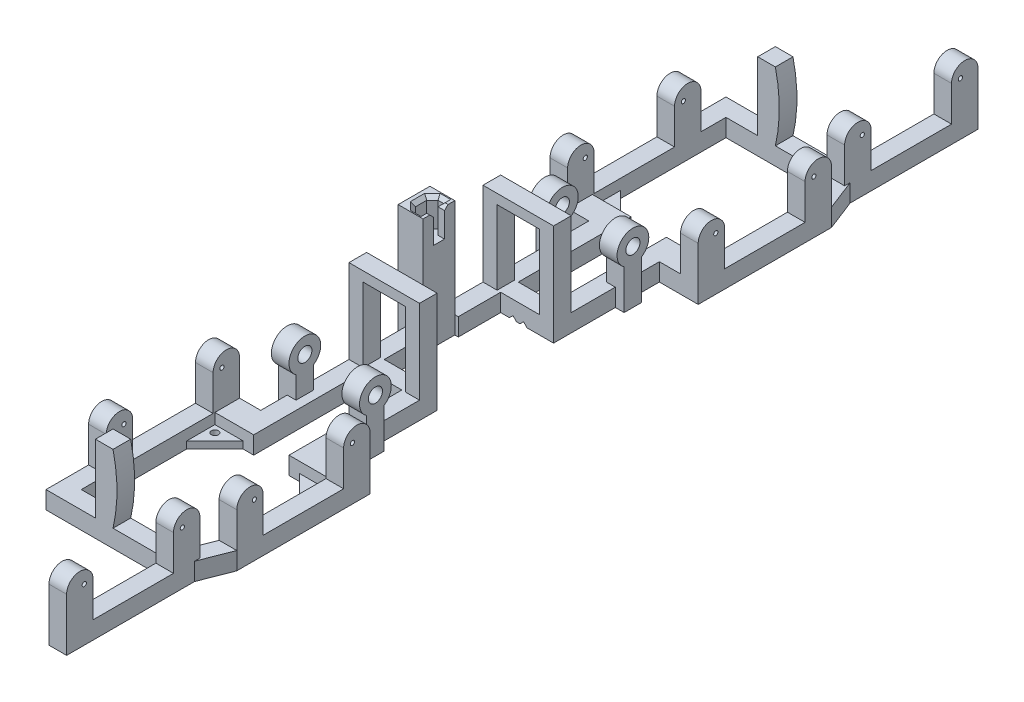
from build123d import *

# Parameters (mm, degrees)
SKETCH_2_5_W               = 5
SKETCH_2_5_H               = 5
RAIL1_DEPTH                = 27.5
ARCHFORTHREAD1_DEPTH       = 2.5
RAIL2_DEPTH                = 2.5
SKETCH_3_W                 = 5
SKETCH_3_H                 = 5
CELLNEST_DEPTH             = 14.5
SKETCH_4_W                 = 7.05
SKETCH_4_H                 = 9
EXTRUDE_6_DEPTH            = 25
EXTRUDE_7_DEPTH            = 8
CHAMFER_1_SIZE             = 1
SKETCH_7_R                 = 2
EXTRUDE_8_DEPTH            = 2.5
SKETCH_12_W                = 16
SKETCH_12_H                = 7
EXTRUDE_9_DEPTH            = 5
SKETCH_13_R                = 0.6
EXTRUDE_10_DEPTH           = 5
EXTRUDE_11_DEPTH           = 5
PATTERN_LINEAR_1_COUNT     = 2
PATTERN_LINEAR_1_PITCH     = 45
EXTRUDE_12_DEPTH           = 5
EXTRUDE_13_DEPTH           = 5
MIRROR_13_COPY_1_DEPTH     = 2.5
MIRROR_13_COPY_2_DEPTH     = 2.5
MIRROR_21_COPY_1_SKETCH_W  = 5
MIRROR_21_COPY_1_SKETCH_H  = 5
MIRROR_21_COPY_1_DEPTH     = 27.5
MIRROR_21_COPY_2_SKETCH_W  = 5
MIRROR_21_COPY_2_SKETCH_H  = 5
MIRROR_21_COPY_2_DEPTH     = 27.5
MIRROR_21_COPY_3_DEPTH     = 2.5
MIRROR_21_COPY_4_DEPTH     = 2.5
MIRROR_22_COPY_1_SKETCH_R  = 2
MIRROR_22_COPY_1_DEPTH     = 2.5
MIRROR_22_COPY_2_SKETCH_R  = 2
MIRROR_22_COPY_2_DEPTH     = 2.5
MIRROR_23_COPY_1_SKETCH_W  = 16
MIRROR_23_COPY_1_SKETCH_H  = 7
MIRROR_23_COPY_1_DEPTH     = 5
MIRROR_23_COPY_2_SKETCH_R  = 0.6
MIRROR_23_COPY_2_DEPTH     = 5
MIRROR_23_COPY_3_SKETCH_W  = 16
MIRROR_23_COPY_3_SKETCH_H  = 7
MIRROR_23_COPY_3_DEPTH     = 5
MIRROR_23_COPY_4_SKETCH_R  = 0.6
MIRROR_23_COPY_4_DEPTH     = 5
MIRROR_25_COPY_1_SKETCH_R  = 0.6
MIRROR_25_COPY_1_DEPTH     = 5
MIRROR_25_COPY_2_SKETCH_R  = 0.6
MIRROR_25_COPY_2_DEPTH     = 5
SKETCH_18_R                = 1
EXTRUDE_14_DEPTH           = 2
MIRROR_2_2_COPY_1_SKETCH_R = 1
MIRROR_2_2_COPY_1_DEPTH    = 2
MIRROR_2_2_COPY_2_SKETCH_R = 1
MIRROR_2_2_COPY_2_DEPTH    = 2
SKETCH1_W                  = 20
SKETCH1_H                  = 5.837148382
CUT_EXTRUDE1_DEPTH         = 10


with BuildPart() as part:
    # Эскиз2<5> → Rail1 (new body)
    with BuildSketch(Plane.XY):
        with Locations((7.5, 2.5)):
            Rectangle(SKETCH_2_5_W, SKETCH_2_5_H)
    rail1 = extrude(amount=-RAIL1_DEPTH)

    # Эскиз2 → ArchForThread1 (add, symmetric)
    with BuildSketch(Plane.XY):
        Polygon((0, 5), (0, 0), (0.5, 0), (1.5, 1), (2.5, 0), (5, 0), (5, 5), align=None)
        Polygon((6, 26), (6, 5), (10, 5), (10, 32), (2.5, 32), (1.5, 31), (0.5, 32), (0, 32), (0, 26), align=None)
    archforthread1 = extrude(amount=ARCHFORTHREAD1_DEPTH, both=True)

    # Mirror 2: ArchForThread1 across plane
    add(archforthread1.mirror(Plane(origin=(0, 0, 0), x_dir=(0, 0, 1), z_dir=(1, 0, 0))))

    # Зеркальное отражение3: Rail1 across plane
    add(rail1.mirror(Plane(origin=(0, 0, 0), x_dir=(0, 0, 1), z_dir=(1, 0, 0))))

    # Эскиз2<6> → Rail2 (add)
    with BuildSketch(Plane.XY):
        Polygon((6, 5), (5, 5), (5, 0), (10, 0), (10, 5), align=None)
    rail2 = extrude(amount=RAIL2_DEPTH)

    # Эскиз3 → CellNest (add)
    with BuildSketch(Plane.XY):
        with Locations((-7.5, 2.5)):
            Rectangle(SKETCH_3_W, SKETCH_3_H)
    cellnest = extrude(amount=CELLNEST_DEPTH)

    # Эскиз4 → Бобышка-Вытянуть6 (add)
    with BuildSketch(Plane(origin=(0, 0, 0), x_dir=(1, 0, 0), z_dir=(0, 1, 0))):
        with Locations((-9.525, -19)):
            Rectangle(SKETCH_4_W, SKETCH_4_H)
    extrude(amount=EXTRUDE_6_DEPTH)

    # Эскиз5 → Бобышка-Вытянуть7 (add)
    with BuildSketch(Plane(origin=(0, 25, 0), x_dir=(1, 0, 0), z_dir=(0, 1, 0))):
        Polygon((-13.05, -23.5), (-6, -23.5), (-6, -20.6), (-7.85, -20.6), (-7.85, -22.2), (-9.45, -22.2), (-11.05, -20.6), (-11.05, -17.4), (-9.45, -15.8), (-7.85, -15.8), (-7.85, -17.4), (-6, -17.4), (-6, -14.5), (-13.05, -14.5), align=None)
    extrude(amount=EXTRUDE_7_DEPTH)

    # Фаска1
    chamfer_1_edges = [part.edges().sort_by_distance(p)[0] for p in [
        (-6.925, 33, 20.6),
        (-7.85, 33, 21.4),
        (-8.65, 33, 22.2),
        (-10.25, 33, 21.4),
        (-6.925, 33, 17.4),
        (-7.85, 33, 16.6),
        (-8.65, 33, 15.8),
        (-10.25, 33, 16.6),
        (-11.05, 33, 19),
    ]]
    chamfer(chamfer_1_edges, length=CHAMFER_1_SIZE)

    # Эскиз7 → Бобышка-Вытянуть8 (add, symmetric)
    with BuildSketch(Plane(origin=(10, 0, 0), x_dir=(0, 0, -1), z_dir=(1, 0, 0))):
        with BuildLine():
            Line((20, 11.258342613), (20, 0))
            Line((20, 0), (15, 0))
            Line((15, 0), (15, 11.258342613))
            ThreePointArc((15, 11.258342613), (17.5, 19.5), (20, 11.258342613))
        make_face()
        with Locations((17.5, 15)):
            Circle(SKETCH_7_R, mode=Mode.SUBTRACT)
    extrude_8 = extrude(amount=EXTRUDE_8_DEPTH, both=True)

    # Зеркальное отражение4: Бобышка-Вытянуть8 across plane
    add(extrude_8.mirror(Plane(origin=(0, 0, 0), x_dir=(0, 0, 1), z_dir=(1, 0, 0))))

    # Эскиз12 → Бобышка-Вытянуть9 (add)
    with BuildSketch(Plane(origin=(0, 0, 0), x_dir=(1, 0, 0), z_dir=(0, 1, 0))):
        with Locations((13, 31)):
            Rectangle(SKETCH_12_W, SKETCH_12_H)
    extrude_9 = extrude(amount=EXTRUDE_9_DEPTH)

    # Эскиз13 → Бобышка-Вытянуть10 (add)
    with BuildSketch(Plane(origin=(21, 0, 0), x_dir=(0, 0, -1), z_dir=(1, 0, 0))):
        with BuildLine():
            Line((27.5, 0), (65.3, 0))
            Line((65.3, 0), (65.3, 15))
            ThreePointArc((65.3, 15), (61.55, 18.75), (57.8, 15))
            Line((57.8, 15), (57.8, 5))
            Line((57.8, 5), (35, 5))
            Line((35, 5), (35, 15))
            ThreePointArc((35, 15), (31.25, 18.75), (27.5, 15))
            Line((27.5, 15), (27.5, 0))
        make_face()
        with Locations((32.5, 15)):
            Circle(SKETCH_13_R, mode=Mode.SUBTRACT)
        with Locations((60.3, 15)):
            Circle(SKETCH_13_R, mode=Mode.SUBTRACT)
    extrude_10 = extrude(amount=-EXTRUDE_10_DEPTH)

    # Зеркальное отражение5: Бобышка-Вытянуть9, Бобышка-Вытянуть10 across plane
    add(extrude_9.mirror(Plane(origin=(0, 0, 0), x_dir=(0, 0, 1), z_dir=(1, 0, 0))))
    add(extrude_10.mirror(Plane(origin=(0, 0, 0), x_dir=(0, 0, 1), z_dir=(1, 0, 0))))

    # Эскиз14 → Бобышка-Вытянуть11 (add)
    with BuildSketch(Plane(origin=(0, 0, 0), x_dir=(1, 0, 0), z_dir=(0, 1, 0))):
        Polygon((21, 65.3), (17.5, 74.3), (12.5, 74.3), (16, 65.3), align=None)
    extrude_11 = extrude(amount=EXTRUDE_11_DEPTH)

    # Линейный массив1: Бобышка-Вытянуть10 ×2
    with Locations(*[Vector(-0.07457805825848672, 0, -0.9972151789991937) * (i * PATTERN_LINEAR_1_PITCH) for i in range(1, PATTERN_LINEAR_1_COUNT)]):
        add(extrude_10)

    # Эскиз15 → Бобышка-Вытянуть12 (add)
    with BuildSketch(Plane(origin=(0, 0, 0), x_dir=(1, 0, 0), z_dir=(0, 1, 0))):
        Polygon((13.248734368, 72.374683055), (-16, 72.374683055), (-16, 65.3), (-21.000237038, 65.3), (-21.000237038, 72.374683055), (-21.000237038, 77.374683055), (13.248734368, 77.374683055), align=None)
    extrude_12 = extrude(amount=EXTRUDE_12_DEPTH)

    # Эскиз16 → Бобышка-Вытянуть13 (add)
    with BuildSketch(Plane(origin=(0, 0, -77.374683055), x_dir=(-1, 0, 0), z_dir=(0, 0, -1))):
        with BuildLine():
            Line((7.000237038, 24.370480215), (2.000237038, 24.370480215))
            ThreePointArc((2.000237038, 24.370480215), (0.881288878, 14.685240107), (2.000237038, 5))
            Line((2.000237038, 5), (7.000237038, 5))
            Line((7.000237038, 5), (7.000237038, 24.370480215))
        make_face()
    extrude_13 = extrude(amount=-EXTRUDE_13_DEPTH)

    # Зеркальное отражение8: CellNest across plane
    add(cellnest.mirror(Plane.XY.offset(19)))

    # Зеркальное отражение13 copy 1 sketch → Зеркальное отражение13 copy 1 (add, symmetric)
    with BuildSketch(Plane(origin=(0, 0, 38), x_dir=(-1, 0, 0), z_dir=(0, 0, -1))):
        Polygon((0, 5), (0, 0), (0.5, 0), (1.5, 1), (2.5, 0), (5, 0), (5, 5), align=None)
        Polygon((6, 26), (6, 5), (10, 5), (10, 32), (2.5, 32), (1.5, 31), (0.5, 32), (0, 32), (0, 26), align=None)
    extrude(amount=MIRROR_13_COPY_1_DEPTH, both=True)

    # Зеркальное отражение13 copy 2 sketch → Зеркальное отражение13 copy 2 (add, symmetric)
    with BuildSketch(Plane(origin=(0, 0, 38), x_dir=(1, 0, 0), z_dir=(0, 0, -1))):
        Polygon((0, -5), (0, 0), (0.5, 0), (1.5, -1), (2.5, 0), (5, 0), (5, -5), align=None)
        Polygon((6, -26), (6, -5), (10, -5), (10, -32), (2.5, -32), (1.5, -31), (0.5, -32), (0, -32), (0, -26), align=None)
    extrude(amount=MIRROR_13_COPY_2_DEPTH, both=True)

    # Зеркальное отражение19: Rail1 across plane
    add(rail1.mirror(Plane.XY.offset(19)))

    # Зеркальное отражение20: Rail2 across plane
    add(rail2.mirror(Plane.XY.offset(19)))

    # Зеркальное отражение21 copy 1 sketch → Зеркальное отражение21 copy 1 (add)
    with BuildSketch(Plane(origin=(0, 0, 38), x_dir=(-1, 0, 0), z_dir=(0, 0, -1))):
        with Locations((7.5, 2.5)):
            Rectangle(MIRROR_21_COPY_1_SKETCH_W, MIRROR_21_COPY_1_SKETCH_H)
    extrude(amount=-MIRROR_21_COPY_1_DEPTH)

    # Зеркальное отражение21 copy 2 sketch → Зеркальное отражение21 copy 2 (add)
    with BuildSketch(Plane(origin=(0, 0, 0), x_dir=(-1, 0, 0), z_dir=(0, 0, 1))):
        with Locations((7.5, -2.5)):
            Rectangle(MIRROR_21_COPY_2_SKETCH_W, MIRROR_21_COPY_2_SKETCH_H)
    extrude(amount=-MIRROR_21_COPY_2_DEPTH)

    # Зеркальное отражение21 copy 3 sketch → Зеркальное отражение21 copy 3 (add)
    with BuildSketch(Plane(origin=(0, 0, 38), x_dir=(-1, 0, 0), z_dir=(0, 0, -1))):
        Polygon((6, 5), (5, 5), (5, 0), (10, 0), (10, 5), align=None)
    extrude(amount=MIRROR_21_COPY_3_DEPTH)

    # Зеркальное отражение21 copy 4 sketch → Зеркальное отражение21 copy 4 (add)
    with BuildSketch(Plane(origin=(0, 0, 0), x_dir=(-1, 0, 0), z_dir=(0, 0, 1))):
        Polygon((6, -5), (5, -5), (5, 0), (10, 0), (10, -5), align=None)
    extrude(amount=MIRROR_21_COPY_4_DEPTH)

    # Зеркальное отражение22 copy 1 sketch → Зеркальное отражение22 copy 1 (add, symmetric)
    with BuildSketch(Plane(origin=(-10, 0, 38), x_dir=(0, 0, 1), z_dir=(-1, 0, 0))):
        with BuildLine():
            Line((20, 11.258342613), (20, 0))
            Line((20, 0), (15, 0))
            Line((15, 0), (15, 11.258342613))
            ThreePointArc((15, 11.258342613), (17.5, 19.5), (20, 11.258342613))
        make_face()
        with Locations((17.5, 15)):
            Circle(MIRROR_22_COPY_1_SKETCH_R, mode=Mode.SUBTRACT)
    extrude(amount=MIRROR_22_COPY_1_DEPTH, both=True)

    # Зеркальное отражение22 copy 2 sketch → Зеркальное отражение22 copy 2 (add, symmetric)
    with BuildSketch(Plane(origin=(10, 0, 38), x_dir=(0, 0, 1), z_dir=(1, 0, 0))):
        with BuildLine():
            Line((20, -11.258342613), (20, 0))
            Line((20, 0), (15, 0))
            Line((15, 0), (15, -11.258342613))
            ThreePointArc((15, -11.258342613), (17.5, -19.5), (20, -11.258342613))
        make_face()
        with Locations((17.5, -15)):
            Circle(MIRROR_22_COPY_2_SKETCH_R, mode=Mode.SUBTRACT)
    extrude(amount=MIRROR_22_COPY_2_DEPTH, both=True)

    # Зеркальное отражение23 copy 1 sketch → Зеркальное отражение23 copy 1 (add)
    with BuildSketch(Plane(origin=(0, 0, 38), x_dir=(-1, 0, 0), z_dir=(0, 1, 0))):
        with Locations((13, 31)):
            Rectangle(MIRROR_23_COPY_1_SKETCH_W, MIRROR_23_COPY_1_SKETCH_H)
    extrude(amount=MIRROR_23_COPY_1_DEPTH)

    # Зеркальное отражение23 copy 2 sketch → Зеркальное отражение23 copy 2 (add)
    with BuildSketch(Plane(origin=(-21, 0, 38), x_dir=(0, 0, 1), z_dir=(-1, 0, 0))):
        with BuildLine():
            Line((27.5, 0), (65.3, 0))
            Line((65.3, 0), (65.3, 15))
            ThreePointArc((65.3, 15), (61.55, 18.75), (57.8, 15))
            Line((57.8, 15), (57.8, 5))
            Line((57.8, 5), (35, 5))
            Line((35, 5), (35, 15))
            ThreePointArc((35, 15), (31.25, 18.75), (27.5, 15))
            Line((27.5, 15), (27.5, 0))
        make_face()
        with Locations((32.5, 15)):
            Circle(MIRROR_23_COPY_2_SKETCH_R, mode=Mode.SUBTRACT)
        with Locations((60.3, 15)):
            Circle(MIRROR_23_COPY_2_SKETCH_R, mode=Mode.SUBTRACT)
    extrude(amount=-MIRROR_23_COPY_2_DEPTH)

    # Зеркальное отражение23 copy 3 sketch → Зеркальное отражение23 copy 3 (add)
    with BuildSketch(Plane(origin=(0, 0, 38), x_dir=(1, 0, 0), z_dir=(0, 1, 0))):
        with Locations((13, -31)):
            Rectangle(MIRROR_23_COPY_3_SKETCH_W, MIRROR_23_COPY_3_SKETCH_H)
    extrude(amount=MIRROR_23_COPY_3_DEPTH)

    # Зеркальное отражение23 copy 4 sketch → Зеркальное отражение23 copy 4 (add)
    with BuildSketch(Plane(origin=(21, 0, 38), x_dir=(0, 0, 1), z_dir=(1, 0, 0))):
        with BuildLine():
            Line((27.5, 0), (65.3, 0))
            Line((65.3, 0), (65.3, -15))
            ThreePointArc((65.3, -15), (61.55, -18.75), (57.8, -15))
            Line((57.8, -15), (57.8, -5))
            Line((57.8, -5), (35, -5))
            Line((35, -5), (35, -15))
            ThreePointArc((35, -15), (31.25, -18.75), (27.5, -15))
            Line((27.5, -15), (27.5, 0))
        make_face()
        with Locations((32.5, -15)):
            Circle(MIRROR_23_COPY_4_SKETCH_R, mode=Mode.SUBTRACT)
        with Locations((60.3, -15)):
            Circle(MIRROR_23_COPY_4_SKETCH_R, mode=Mode.SUBTRACT)
    extrude(amount=-MIRROR_23_COPY_4_DEPTH)

    # Зеркальное отражение24: Бобышка-Вытянуть11 across plane
    add(extrude_11.mirror(Plane.XY.offset(19)))

    # Зеркальное отражение25 copy 1 sketch → Зеркальное отражение25 copy 1 (add)
    with BuildSketch(Plane(origin=(17.643987378, 0, 82.874683055), x_dir=(0, 0, 1), z_dir=(1, 0, 0))):
        with BuildLine():
            Line((27.5, 0), (65.3, 0))
            Line((65.3, 0), (65.3, -15))
            ThreePointArc((65.3, -15), (61.55, -18.75), (57.8, -15))
            Line((57.8, -15), (57.8, -5))
            Line((57.8, -5), (35, -5))
            Line((35, -5), (35, -15))
            ThreePointArc((35, -15), (31.25, -18.75), (27.5, -15))
            Line((27.5, -15), (27.5, 0))
        make_face()
        with Locations((32.5, -15)):
            Circle(MIRROR_25_COPY_1_SKETCH_R, mode=Mode.SUBTRACT)
        with Locations((60.3, -15)):
            Circle(MIRROR_25_COPY_1_SKETCH_R, mode=Mode.SUBTRACT)
    extrude(amount=-MIRROR_25_COPY_1_DEPTH)

    # Зеркальное отражение25 copy 2 sketch → Зеркальное отражение25 copy 2 (add)
    with BuildSketch(Plane(origin=(21, 0, 38), x_dir=(0, 0, 1), z_dir=(1, 0, 0))):
        with BuildLine():
            Line((27.5, 0), (65.3, 0))
            Line((65.3, 0), (65.3, -15))
            ThreePointArc((65.3, -15), (61.55, -18.75), (57.8, -15))
            Line((57.8, -15), (57.8, -5))
            Line((57.8, -5), (35, -5))
            Line((35, -5), (35, -15))
            ThreePointArc((35, -15), (31.25, -18.75), (27.5, -15))
            Line((27.5, -15), (27.5, 0))
        make_face()
        with Locations((32.5, -15)):
            Circle(MIRROR_25_COPY_2_SKETCH_R, mode=Mode.SUBTRACT)
        with Locations((60.3, -15)):
            Circle(MIRROR_25_COPY_2_SKETCH_R, mode=Mode.SUBTRACT)
    extrude(amount=-MIRROR_25_COPY_2_DEPTH)

    # Зеркальное отражение26: Бобышка-Вытянуть12, Бобышка-Вытянуть13 across plane
    add(extrude_12.mirror(Plane.XY.offset(19)))
    add(extrude_13.mirror(Plane.XY.offset(19)))

    # Эскиз18 → Бобышка-Вытянуть14 (add)
    with BuildSketch(Plane(origin=(0, 0, 0), x_dir=(1, 0, 0), z_dir=(0, 1, 0))):
        Polygon((16, 34.5), (8, 34.5), (16, 42.5), align=None)
        with Locations((14, 36.5)):
            Circle(SKETCH_18_R, mode=Mode.SUBTRACT)
    extrude_14 = extrude(amount=EXTRUDE_14_DEPTH)

    # Mirror 5169: Бобышка-Вытянуть14 across plane
    add(extrude_14.mirror(Plane(origin=(0, 0, 0), x_dir=(0, 0, 1), z_dir=(1, 0, 0))))

    # Mirror 2 2 copy 1 sketch → Mirror 2 2 copy 1 (add)
    with BuildSketch(Plane(origin=(0, 0, 38), x_dir=(-1, 0, 0), z_dir=(0, 1, 0))):
        Polygon((16, 34.5), (8, 34.5), (16, 42.5), align=None)
        with Locations((14, 36.5)):
            Circle(MIRROR_2_2_COPY_1_SKETCH_R, mode=Mode.SUBTRACT)
    extrude(amount=MIRROR_2_2_COPY_1_DEPTH)

    # Mirror 2 2 copy 2 sketch → Mirror 2 2 copy 2 (add)
    with BuildSketch(Plane(origin=(0, 0, 38), x_dir=(1, 0, 0), z_dir=(0, 1, 0))):
        Polygon((16, -34.5), (8, -34.5), (16, -42.5), align=None)
        with Locations((14, -36.5)):
            Circle(MIRROR_2_2_COPY_2_SKETCH_R, mode=Mode.SUBTRACT)
    extrude(amount=MIRROR_2_2_COPY_2_DEPTH)

    # Sketch1 → Cut-Extrude1 (cut)
    with BuildSketch(Plane(origin=(0, 0, -2.5), x_dir=(-1, 0, 0), z_dir=(0, 0, -1))):
        with Locations((0, 31.694330195)):
            Rectangle(SKETCH1_W, SKETCH1_H)
    cut_extrude1 = extrude(amount=-CUT_EXTRUDE1_DEPTH, mode=Mode.SUBTRACT)

    # Mirror1: Cut-Extrude1 across plane
    add(cut_extrude1.mirror(Plane.XY.offset(19)), mode=Mode.SUBTRACT)


solid = part.part
